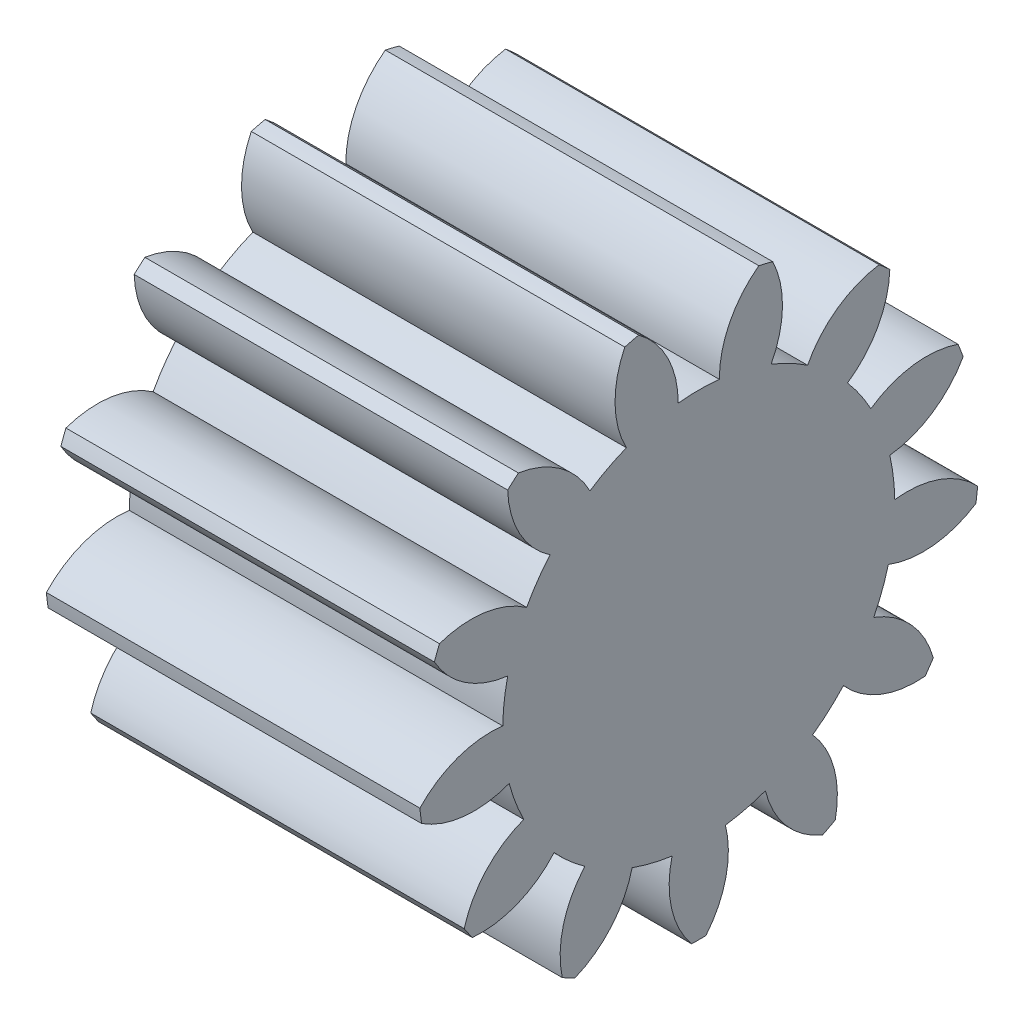
from build123d import *

# Parameters (mm, degrees)
BASPROSKE_W     = 6
BASPROSKE_H     = 4.5
TOOTHCUT_DEPTH  = 9.746427842
TEETHCUTS_COUNT = 13


with BuildPart() as part:
    # BasProSke → Base-Revolve (revolve)
    with BuildSketch(Plane(origin=(0, 0, 0), x_dir=(1, 0, 0), z_dir=(0, 1, 0))):
        with Locations((3, 2.25)):
            Rectangle(BASPROSKE_W, BASPROSKE_H)
    revolve(axis=Axis((-10, 0, 0), (1, 0, 0)))

    # TooCutSke → ToothCut (cut, through all)
    with BuildSketch(Plane(origin=(0, 0, 0), x_dir=(0, 0, -1), z_dir=(1, 0, 0))):
        with BuildLine():
            ThreePointArc((0.330578579, 3.131600039), (0, 3.149), (-0.330578579, 3.131600039))
            ThreePointArc((-0.330578579, 3.131600039), (-0.504119116, 3.854627805), (-0.992642471, 4.415190379))
            ThreePointArc((-0.992642471, 4.415190379), (0, 4.5254), (0.992642471, 4.415190379))
            ThreePointArc((0.992642471, 4.415190379), (0.504119116, 3.854627805), (0.330578579, 3.131600039))
        make_face()
    toothcut = extrude(amount=TOOTHCUT_DEPTH, mode=Mode.SUBTRACT)

    # TeethCuts: ToothCut ×13 about axis
    teethcuts_axis = Axis((-10, 0, 0), (1, 0, 0))
    for i in range(1, TEETHCUTS_COUNT):
        add(toothcut.rotate(teethcuts_axis, i * 360 / TEETHCUTS_COUNT), mode=Mode.SUBTRACT)


solid = part.part
